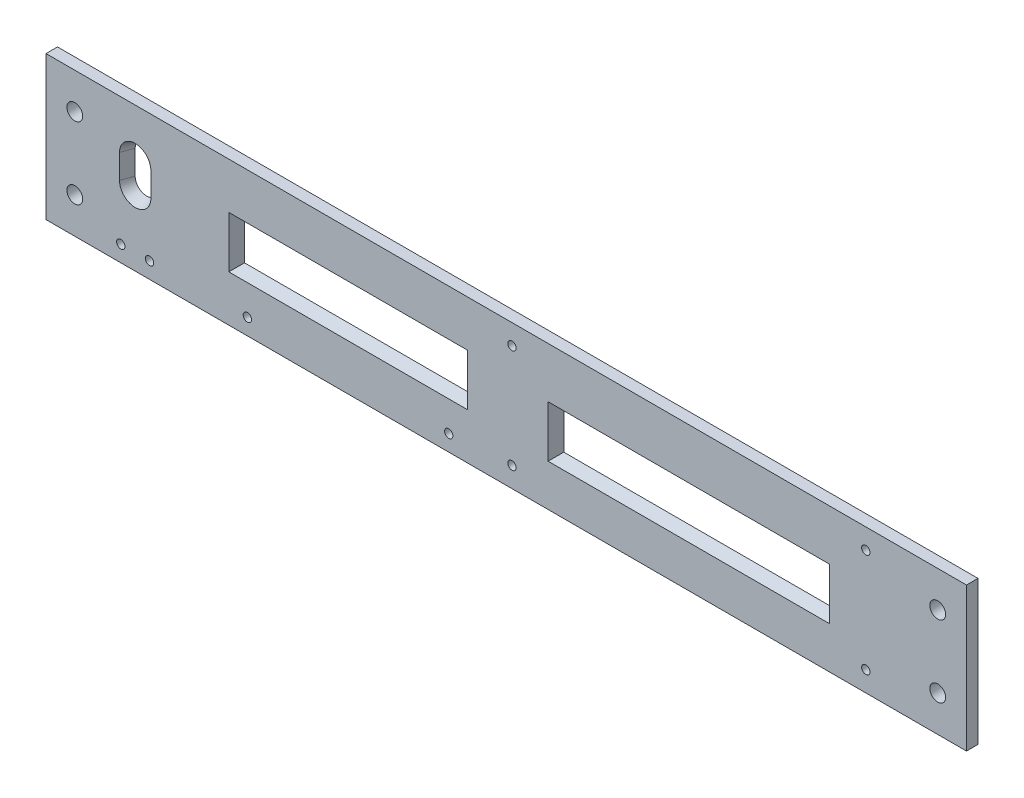
from build123d import *

# Parameters (mm, degrees)
SKETCH1_W                     = 320
SKETCH1_H                     = 50
BOSS_EXTRUDE1_DEPTH           = 4
M5_CLEARANCE_HOLE1_AT_2_COUNT = 2
M5_CLEARANCE_HOLE1_AT_2_PITCH = 300
LPATTERN1_COUNT               = 2
LPATTERN1_PITCH               = 25
SKETCH5_W                     = 80
SKETCH5_H                     = 15
CUT_EXTRUDE1_DEPTH            = 324.907394173
CUT_EXTRUDE3_DEPTH            = 324.907394173
SKETCH9_W                     = 95
SKETCH9_H                     = 15
CUT_EXTRUDE4_DEPTH            = 324.907394173
M2_5_CLEARANCE_HOLE1_D        = 2.9
DRAFT1_ANGLE                  = -20


with BuildPart() as part:
    # Sketch1 → Boss-Extrude1 (new body)
    with BuildSketch(Plane.XY):
        with Locations((160, 25)):
            Rectangle(SKETCH1_W, SKETCH1_H)
    extrude(amount=BOSS_EXTRUDE1_DEPTH)

    # Sketch4 → M5 Clearance Hole1 (revolve, cut)
    with BuildSketch(Plane(origin=(310, 37.5, 4), x_dir=(0, -1, 0), z_dir=(1, 0, 0))):
        Polygon((0, 0), (0, 15.652366702), (2.75, 14), (2.75, 0), align=None)
    m5_clearance_hole1 = revolve(axis=Axis((310, 37.5, 10.35), (0, 0, -1)), mode=Mode.SUBTRACT)

    # M5 Clearance Hole1 at 2: M5 Clearance Hole1 ×2
    with Locations(*[(-i * M5_CLEARANCE_HOLE1_AT_2_PITCH, 0, 0) for i in range(1, M5_CLEARANCE_HOLE1_AT_2_COUNT)]):
        add(m5_clearance_hole1, mode=Mode.SUBTRACT)

    # LPattern1: M5 Clearance Hole1 ×2
    with Locations(*[(0, -i * LPATTERN1_PITCH, 0) for i in range(1, LPATTERN1_COUNT)]):
        add(m5_clearance_hole1, mode=Mode.SUBTRACT)

    # LPattern1 copy 1 sketch → LPattern1 copy 1 (revolve, cut)
    with BuildSketch(Plane(origin=(10, 12.5, 4), x_dir=(0, -1, 0), z_dir=(1, 0, 0))):
        Polygon((0, 0), (0, 15.652366702), (2.75, 14), (2.75, 0), align=None)
    revolve(axis=Axis((10, 12.5, 10.35), (0, 0, -1)), mode=Mode.SUBTRACT)

    # Sketch5 → Cut-Extrude1 (cut, through all)
    with BuildSketch(Plane.XY.offset(4)):
        with Locations((105, 25)):
            Rectangle(SKETCH5_W, SKETCH5_H)
    extrude(amount=-CUT_EXTRUDE1_DEPTH, mode=Mode.SUBTRACT)

    # Sketch6 → Cut-Extrude3 (cut, through all)
    with BuildSketch(Plane.XY.offset(4)):
        with BuildLine():
            Line((27, 24.6), (27, 33))
            ThreePointArc((27, 33), (31, 37), (35, 33))
            Line((35, 33), (35, 24.6))
            ThreePointArc((35, 24.6), (31, 20.6), (27, 24.6))
        make_face()
    extrude(amount=-CUT_EXTRUDE3_DEPTH, mode=Mode.SUBTRACT)

    # Sketch9 → Cut-Extrude4 (cut, through all)
    with BuildSketch(Plane.XY.offset(4)):
        with Locations((223.5, 23.5)):
            Rectangle(SKETCH9_W, SKETCH9_H)
    extrude(amount=-CUT_EXTRUDE4_DEPTH, mode=Mode.SUBTRACT)

    # M2.5 Clearance Hole1 (through all)
    with Locations(Plane.XY.offset(4)):
        with Locations((285, 43), (26, 5.6), (36, 5.6), (70, 5.6), (140, 5.6), (162, 43), (162, 7), (285, 7)):
            Hole(M2_5_CLEARANCE_HOLE1_D / 2)

    # Draft1
    draft1_faces = [part.faces().sort_by_distance(p)[0] for p in [
        (223.5, 16, 2),
        (271, 23.5, 2),
        (223.5, 31, 2),
        (176, 23.5, 2),
        (145, 25, 2),
        (105, 32.5, 2),
        (65, 25, 2),
        (105, 17.5, 2),
        (35, 28.8, 2),
        (31, 37, 2),
        (27, 28.8, 2),
        (31, 20.6, 2),
    ]]
    draft(draft1_faces, Plane(origin=(0, 0, 0), x_dir=(-1, 0, 0), z_dir=(0, 0, -1)), DRAFT1_ANGLE)


solid = part.part
